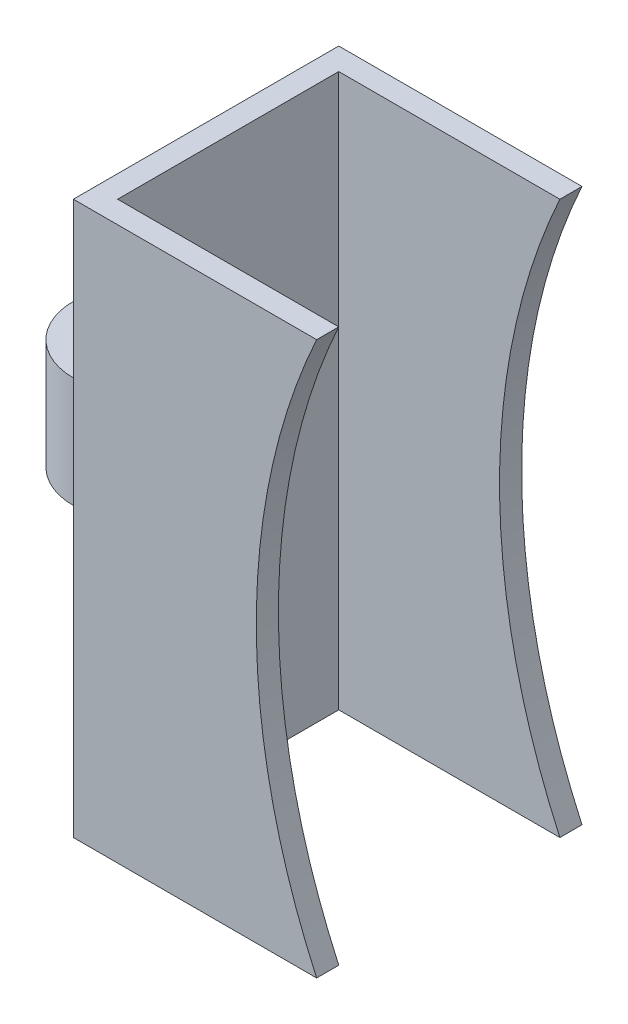
from build123d import *

# Parameters (mm, degrees)
BOSS_EXTRUDE1_DEPTH     = 50
CUT_EXTRUDE1_DEPTH      = 59.957611892
CUT_EXTRUDE1_DEPTH_BACK = 59.957611892
SKETCH3_R               = 60
BOSS_EXTRUDE2_START     = -30
SKETCH4_R               = 6
SKETCH4_R_2             = 4
BOSS_EXTRUDE2_DEPTH     = 10


with BuildPart() as part:
    # Sketch1 → Boss-Extrude1 (new body)
    with BuildSketch(Plane(origin=(0, 0, 0), x_dir=(1, 0, 0), z_dir=(0, 1, 0))):
        Polygon((0, 0), (0, 20), (20, 20), (20, 22), (-2, 22), (-2, -2), (20, -2), (20, 0), align=None)
    extrude(amount=BOSS_EXTRUDE1_DEPTH)

    # Sketch3 → Cut-Extrude1 (cut, two sides: drawn at the far end of the back side and taken through both)
    with BuildSketch(Plane(origin=(0, 0, -22), x_dir=(-1, 0, 0), z_dir=(0, 0, -1)).offset(-CUT_EXTRUDE1_DEPTH_BACK)):
        with Locations((-74.543560573, 25)):
            Circle(SKETCH3_R)
    extrude(amount=CUT_EXTRUDE1_DEPTH + CUT_EXTRUDE1_DEPTH_BACK, mode=Mode.SUBTRACT)


with BuildPart() as body_2:
    # Sketch4 → Boss-Extrude2 (new body)
    with BuildSketch(Plane(origin=(0, 50, 0), x_dir=(1, 0, 0), z_dir=(0, 1, 0)).offset(BOSS_EXTRUDE2_START)):
        with Locations((-8, 10)):
            Circle(SKETCH4_R)
        with Locations((-8, 10)):
            Circle(SKETCH4_R_2, mode=Mode.SUBTRACT)
    extrude(amount=BOSS_EXTRUDE2_DEPTH)


solid = Compound([part.part, body_2.part])
